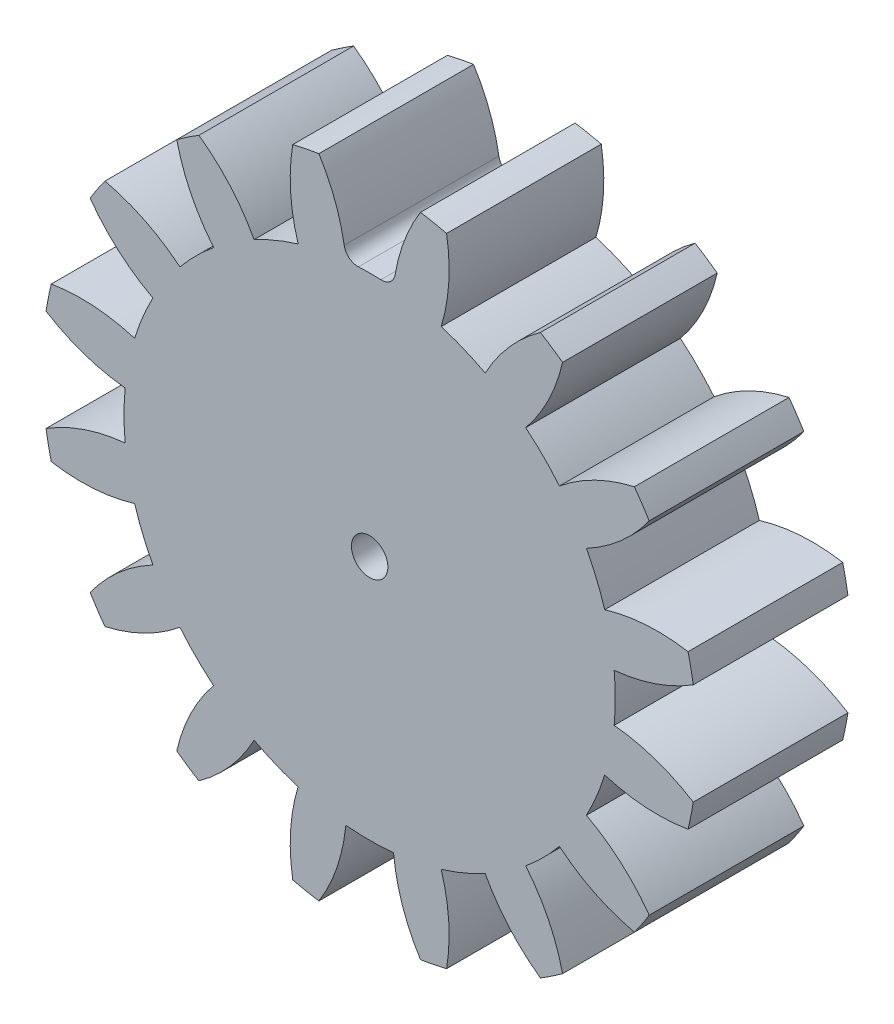
from build123d import *

# Parameters (mm, degrees)
SKETCH1_R           = 18
SKETCH1_R_2         = 1
BOSS_EXTRUDE1_DEPTH = 4.25
CUT_EXTRUDE1_DEPTH  = 26.808186686
FILLET1_R           = 0.76
CIRPATTERN3_COUNT   = 16


with BuildPart() as part:
    # Sketch1 → Boss-Extrude1 (new, symmetric)
    with BuildSketch(Plane.XY):
        Circle(SKETCH1_R)
        Circle(SKETCH1_R_2, mode=Mode.SUBTRACT)
    extrude(amount=BOSS_EXTRUDE1_DEPTH, both=True)

    # Sketch2 → Cut-Extrude1 (cut, symmetric)
    with BuildSketch(Plane.XY):
        with BuildLine():
            ThreePointArc((1.30964585, 13.436324935), (0, 13.5), (-1.30964585, 13.436324935))
            ThreePointArc((-1.30964585, 13.436324935), (-1.797691495, 15.695338881), (-2.790435992, 17.782392049))
            ThreePointArc((-2.790435992, 17.782392049), (0, 18), (2.790435992, 17.782392049))
            ThreePointArc((2.790435992, 17.782392049), (1.797691495, 15.695338881), (1.30964585, 13.436324935))
        make_face()
    cut_extrude1 = extrude(amount=CUT_EXTRUDE1_DEPTH, both=True, mode=Mode.SUBTRACT)

    # Fillet1
    fillet1_edges = [part.edges().sort_by_distance(p)[0] for p in [
        (1.30964585, 13.436324935, 0),
        (-1.30964585, 13.436324935, 0),
    ]]
    fillet(fillet1_edges, radius=FILLET1_R)

    # CirPattern3: Cut-Extrude1 ×16 about axis
    cirpattern3_axis = Axis((0, 0, 4.25), (0, 0, -1))
    for i in range(1, CIRPATTERN3_COUNT):
        add(cut_extrude1.rotate(cirpattern3_axis, i * 360 / CIRPATTERN3_COUNT), mode=Mode.SUBTRACT)


solid = part.part
